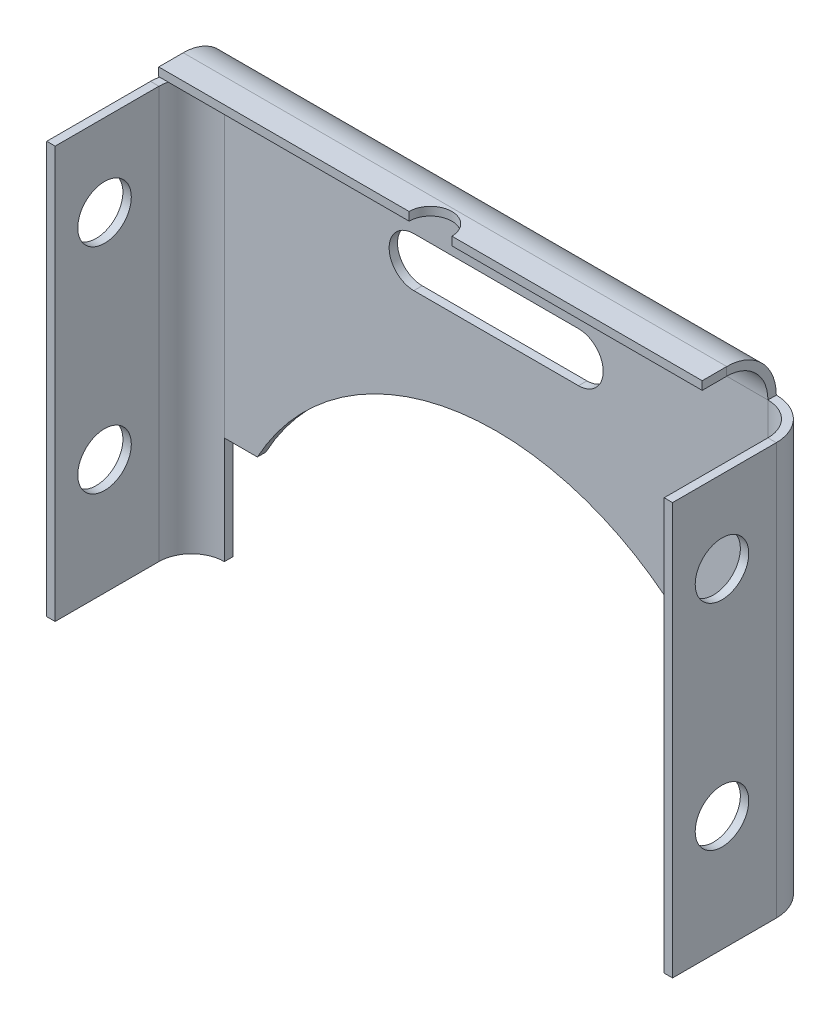
from build123d import *

# Parameters (mm, degrees)
BASE_FLANGE2_DEPTH      = 2.5
EDGE_FLANGE1_DEPTH      = 3.3
CUT_EXTRUDE4_DEPTH      = 3
CUT_EXTRUDE5_DEPTH      = 5.632968811
CUT_EXTRUDE5_DEPTH_BACK = 5.632968811
SKETCH14_R              = 0.1625
CUT_EXTRUDE8_DEPTH      = 0.051


# Sheet-metal steps are written as plain solids
with BuildPart() as part:
    # Sketch1 → Base-Flange2 (new body)
    with BuildSketch(Plane(origin=(0, 0, 0), x_dir=(1, 0, 0), z_dir=(0, 1, 0))):
        with BuildLine():
            Line((-1.9, -0.88), (-1.9, -0.25))
            ThreePointArc((-1.9, -0.25), (-1.826776695, -0.073223305), (-1.65, 0))
            Line((-1.65, 0), (1.65, 0))
            ThreePointArc((1.65, 0), (1.826776695, -0.073223305), (1.9, -0.25))
            Line((1.9, -0.25), (1.9, -0.88))
            Line((1.9, -0.88), (1.849, -0.88))
            Line((1.849, -0.88), (1.849, -0.25))
            ThreePointArc((1.849, -0.25), (1.790714249, -0.109285751), (1.65, -0.051))
            Line((1.65, -0.051), (-1.65, -0.051))
            ThreePointArc((-1.65, -0.051), (-1.790714249, -0.109285751), (-1.849, -0.25))
            Line((-1.849, -0.25), (-1.849, -0.88))
            Line((-1.849, -0.88), (-1.9, -0.88))
        make_face()
    extrude(amount=-BASE_FLANGE2_DEPTH)

    # Edge-Flange1 section (across the edge) → Edge-Flange1 (add)
    with BuildSketch(Plane(origin=(1.65, 0.25, 0.051), x_dir=(0, -1, 0), z_dir=(-1, 0, 0))):
        with BuildLine():
            Line((-0.051, 0.25), (-0.051, 0.399))
            Line((-0.051, 0.399), (0, 0.399))
            Line((0, 0.399), (0, 0.25))
            ThreePointArc((0, 0.25), (0.073223305, 0.073223305), (0.25, 0))
            Line((0.25, 0), (0.25, -0.051))
            ThreePointArc((0.25, -0.051), (0.037160859, 0.037160859), (-0.051, 0.25))
        make_face()
    extrude(amount=EDGE_FLANGE1_DEPTH)

    # Sketch13 → Cut-Extrude4 (cut)
    with BuildSketch(Plane.XY.offset(0.051)):
        with BuildLine():
            Line((-0.5, -0.2), (0.5, -0.2))
            ThreePointArc((0.5, -0.2), (0.65, -0.35), (0.5, -0.5))
            Line((0.5, -0.5), (-0.5, -0.5))
            ThreePointArc((-0.5, -0.5), (-0.65, -0.35), (-0.5, -0.2))
        make_face()
        with BuildLine():
            Line((1.65, -2.5), (1.65, -1.85))
            Line((1.65, -1.85), (1.45, -1.85))
            ThreePointArc((1.45, -1.85), (0, -0.987400787), (-1.45, -1.85))
            Line((-1.45, -1.85), (-1.65, -1.85))
            Line((-1.65, -1.85), (-1.65, -2.5))
            Line((-1.65, -2.5), (1.65, -2.5))
        make_face()
    extrude(amount=-CUT_EXTRUDE4_DEPTH, mode=Mode.SUBTRACT)

    # Sketch14 → Cut-Extrude5 (cut, two sides: drawn at the far end of the back side and taken through both)
    with BuildSketch(Plane.ZY.offset(1.9).offset(-CUT_EXTRUDE5_DEPTH_BACK)):
        with Locations((0.58, -0.498518338)):
            Circle(SKETCH14_R)
        with Locations((0.58, -1.798518338)):
            Circle(SKETCH14_R)
    extrude(amount=CUT_EXTRUDE5_DEPTH + CUT_EXTRUDE5_DEPTH_BACK, mode=Mode.SUBTRACT)

    # Sketch15 → Cut-Extrude8 (cut)
    with BuildSketch(Plane(origin=(0, 0.301, 0), x_dir=(1, 0, 0), z_dir=(0, 1, 0))):
        with BuildLine():
            Line((-0.13, -0.45), (0.13, -0.45))
            ThreePointArc((0.13, -0.45), (0, -0.32), (-0.13, -0.45))
        make_face()
    extrude(amount=-CUT_EXTRUDE8_DEPTH, mode=Mode.SUBTRACT)


solid = part.part
